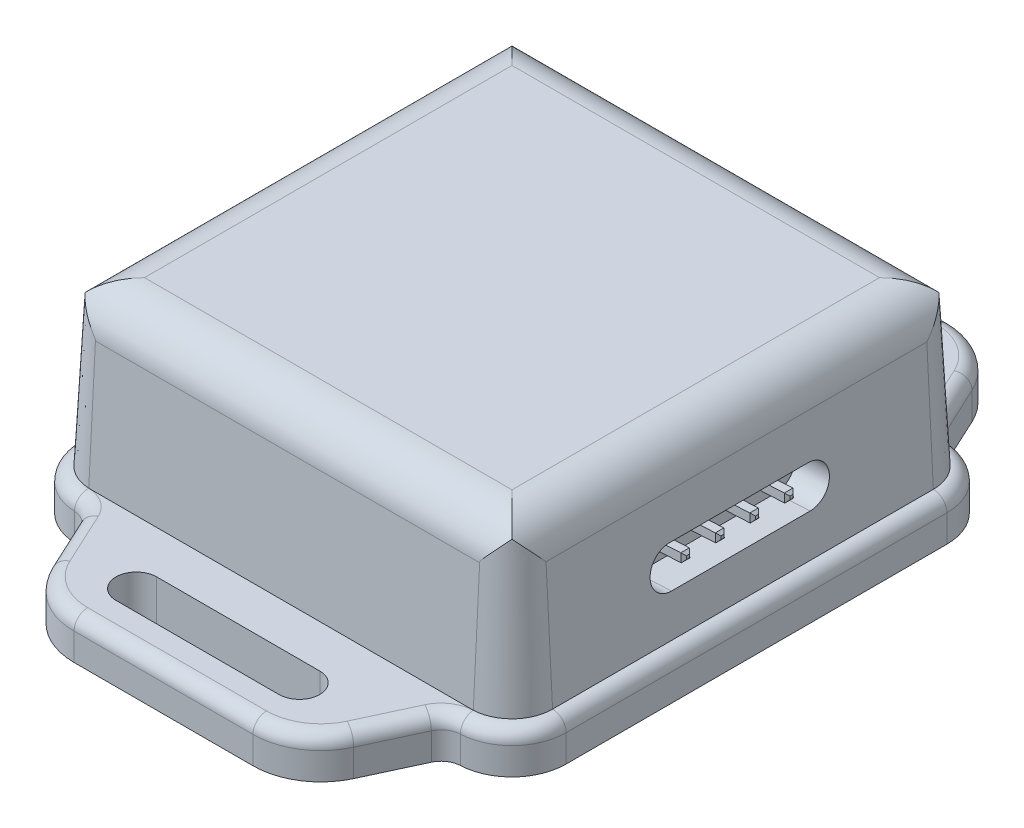
from build123d import *

# Parameters (mm, degrees)
EXTRUDE_1_DEPTH     = 3
FILLET_1_R          = 1
EXTRUDE_2_DEPTH     = 12
EXTRUDE_2_TAPER     = 3
FILLET_3_R          = 3
FILLET_4_R          = 3
CUT_EXTRUDE_1_DEPTH = 2.54
SKETCH_5_W          = 0.63
SKETCH_5_H          = 0.63
EXTRUDE_3_DEPTH     = 2.54
CHAMFER_2_SIZE      = 0.2
CHAMFER_3_SIZE      = 0.2
CUT_EXTRUDE_2_DEPTH = 5.08
EXTRUDE_4_DEPTH     = 2.54
SKETCH_8_R          = 1.5
CUT_EXTRUDE_3_DEPTH = 0.1


with BuildPart() as part:
    # 草图1 → 凸台-拉伸1 (new body)
    with BuildSketch(Plane(origin=(0, 0, 0), x_dir=(1, 0, 0), z_dir=(0, 1, 0))):
        with BuildLine():
            ThreePointArc((11.109578501, 22.761132302), (9.268225449, 24.866230509), (6.58350481, 25.65))
            Line((6.58350481, 25.65), (-6.58350481, 25.65))
            ThreePointArc((-6.58350481, 25.65), (-9.268225449, 24.866230509), (-11.109578501, 22.761132302))
            Line((-11.109578501, 22.761132302), (-12.92017347, 18.860908481))
            ThreePointArc((-12.92017347, 18.860908481), (-13.440232827, 18.25183334), (-14.200505299, 18))
            ThreePointArc((-14.200505299, 18), (-16.897924527, 16.767729012), (-18, 14.014550498))
            Line((-18, 14.014550498), (-18, 13.985449502))
            Line((-18, 13.985449502), (-18, -13.985449502))
            Line((-18, -13.985449502), (-18, -14.014550498))
            ThreePointArc((-18, -14.014550498), (-16.897924527, -16.767729012), (-14.200505299, -18))
            ThreePointArc((-14.200505299, -18), (-13.440232827, -18.25183334), (-12.92017347, -18.860908481))
            Line((-12.92017347, -18.860908481), (-11.109578501, -22.761132302))
            ThreePointArc((-11.109578501, -22.761132302), (-9.268225449, -24.866230509), (-6.58350481, -25.65))
            Line((-6.58350481, -25.65), (6.58350481, -25.65))
            ThreePointArc((6.58350481, -25.65), (9.268225449, -24.866230509), (11.109578501, -22.761132302))
            Line((11.109578501, -22.761132302), (12.92017347, -18.860908481))
            ThreePointArc((12.92017347, -18.860908481), (13.440232827, -18.25183334), (14.200505299, -18))
            ThreePointArc((14.200505299, -18), (16.897924527, -16.767729012), (18, -14.014550498))
            Line((18, -14.014550498), (18, 14.014550498))
            ThreePointArc((18, 14.014550498), (16.897924527, 16.767729012), (14.200505299, 18))
            ThreePointArc((14.200505299, 18), (13.440232827, 18.25183334), (12.92017347, 18.860908481))
            Line((12.92017347, 18.860908481), (11.109578501, 22.761132302))
        make_face()
        with BuildLine():
            Line((6, -23.15), (-6, -23.15))
            ThreePointArc((-6, -23.15), (-7.5, -21.65), (-6, -20.15))
            Line((-6, -20.15), (6, -20.15))
            ThreePointArc((6, -20.15), (7.5, -21.65), (6, -23.15))
        make_face(mode=Mode.SUBTRACT)
        with BuildLine():
            ThreePointArc((-6, 20.15), (-7.5, 21.65), (-6, 23.15))
            Line((-6, 23.15), (6, 23.15))
            ThreePointArc((6, 23.15), (7.5, 21.65), (6, 20.15))
            Line((6, 20.15), (-6, 20.15))
        make_face(mode=Mode.SUBTRACT)
    extrude(amount=EXTRUDE_1_DEPTH)

    # 圆角1
    fillet_1_edges = [part.edges().sort_by_distance(p)[0] for p in [
        (-12.014875986, 3, 20.811020391),
        (-9.268225449, 3, 24.866230509),
        (0, 3, 25.65),
        (9.268225449, 3, 24.866230509),
        (12.014875986, 3, 20.811020391),
        (13.440232827, 3, 18.25183334),
        (16.897924527, 3, 16.767729012),
        (18, 3, 0),
        (16.897924527, 3, -16.767729012),
        (13.440232827, 3, -18.25183334),
        (12.014875986, 3, -20.811020391),
        (9.268225449, 3, -24.866230509),
        (0, 3, -25.65),
        (-9.268225449, 3, -24.866230509),
        (-12.014875986, 3, -20.811020391),
        (-13.440232827, 3, -18.25183334),
        (-16.897924527, 3, -16.767729012),
        (-18, 3, 0),
        (-16.897924527, 3, 16.767729012),
        (-13.440232827, 3, 18.25183334),
    ]]
    fillet(fillet_1_edges, radius=FILLET_1_R)

    # 草图2 → 凸台-拉伸2 (add)
    with BuildSketch(Plane(origin=(0, 3, 0), x_dir=(1, 0, 0), z_dir=(0, 1, 0))):
        with BuildLine():
            ThreePointArc((-14.15275961, 17.001140476), (-16.174133919, 16.077709334), (-17, 14.014550498))
            Line((-17, 14.014550498), (-17, -14.014550498))
            ThreePointArc((-17, -14.014550498), (-16.174133919, -16.077709334), (-14.15275961, -17.001140476))
            Line((-14.15275961, -17.001140476), (14.15275961, -17.001140476))
            ThreePointArc((14.15275961, -17.001140476), (16.174133919, -16.077709334), (17, -14.014550498))
            Line((17, -14.014550498), (17, 14.014550498))
            ThreePointArc((17, 14.014550498), (16.174133919, 16.077709334), (14.15275961, 17.001140476))
            Line((14.15275961, 17.001140476), (-14.15275961, 17.001140476))
        make_face()
    extrude(amount=EXTRUDE_2_DEPTH, taper=EXTRUDE_2_TAPER)

    # 圆角3
    # the kernel refuses this fillet: 3 mm, written as the material it takes off along each edge
    with BuildSketch(Plane(origin=(-21.254085444, 15, 16.372247124), x_dir=(0, 0, -1), z_dir=(1, 0, 0))) as fillet_3_piece_1:
        with BuildLine():
            CenterArc((FILLET_3_R * 0.948964566715, -FILLET_3_R), FILLET_3_R, 90, 87)
            Line((-FILLET_3_R * 0.0496649680397, -FILLET_3_R * 0.947664043757), (0, 0))
            Line((0, 0), (FILLET_3_R * 0.948964566715, 0))
        make_face()
    extrude(amount=42.508170888, mode=Mode.SUBTRACT)
    with BuildSketch(Plane(origin=(21.254085444, 15, -16.372247124), x_dir=(0, -0.9986295347545739, -0.05233595624294369), z_dir=(-1, 0, 0))) as fillet_3_piece_2:
        with BuildLine():
            CenterArc((FILLET_3_R * 0.948964566715, FILLET_3_R), FILLET_3_R, 183, 87)
            Line((-FILLET_3_R * 0.0496649680397, FILLET_3_R * 0.947664043757), (0, 0))
            Line((0, 0), (FILLET_3_R * 0.948964566715, 0))
        make_face()
    extrude(amount=42.508170888, mode=Mode.SUBTRACT)

    # 圆角4
    # the kernel refuses this fillet: 3 mm, written as the material it takes off along each edge
    with BuildSketch(Plane(origin=(-16.371106649, 15, -20.642587675), x_dir=(-0.052335956242944966, -0.9986295347545738, 0), z_dir=(0, 0, 1)), Plane(origin=(16.371106649, 15, 20.642587675), x_dir=(0.05233595624294368, -0.9986295347545738, 0), z_dir=(0, 0, -1))) as fillet_4_piece_1:
        with BuildLine():
            CenterArc((FILLET_4_R * 0.948964566715, FILLET_4_R), FILLET_4_R, 183, 87)
            Line((-FILLET_4_R * 0.0496649680397, FILLET_4_R * 0.947664043757), (0, 0))
            Line((0, 0), (FILLET_4_R * 0.948964566715, 0))
        make_face()
    extrude(amount=41.285175349, mode=Mode.SUBTRACT)

    # 草图4 → 切除-拉伸1 (cut)
    with BuildSketch(Plane(origin=(17.110228806, 0.896709095, 0), x_dir=(0, 0, -1), z_dir=(0.998629534754574, 0.05233595624294391, 0))):
        with BuildLine():
            Line((-5.1, 8.106177348), (5.1, 8.106177348))
            ThreePointArc((5.1, 8.106177348), (6.6, 6.606177348), (5.1, 5.106177348))
            Line((5.1, 5.106177348), (-5.1, 5.106177348))
            ThreePointArc((-5.1, 5.106177348), (-6.6, 6.606177348), (-5.1, 8.106177348))
        make_face()
    extrude(amount=-CUT_EXTRUDE_1_DEPTH, mode=Mode.SUBTRACT)

    # 草图5 → 凸台-拉伸3 (add)
    with BuildSketch(Plane(origin=(14.573709787, 0.763775766, 0), x_dir=(0, 0, -1), z_dir=(0.998629534754574, 0.05233595624294393, 0))):
        with Locations((-1.27, 6.606177348)):
            Rectangle(SKETCH_5_W, SKETCH_5_H)
        with Locations((-3.81, 6.606177348)):
            Rectangle(SKETCH_5_W, SKETCH_5_H)
        with Locations((1.27, 6.606177348)):
            Rectangle(SKETCH_5_W, SKETCH_5_H)
        with Locations((3.81, 6.606177348)):
            Rectangle(SKETCH_5_W, SKETCH_5_H)
    extrude(amount=EXTRUDE_3_DEPTH)

    # 倒角2
    chamfer_2_edges = [part.edges().sort_by_distance(p)[0] for p in [
        (16.780974023, 7.179264603, 3.81),
        (16.764488197, 7.493832906, 4.125),
        (16.748002371, 7.80840121, 3.81),
        (16.764488197, 7.493832906, 3.495),
    ]]
    chamfer(chamfer_2_edges, length=CHAMFER_2_SIZE)

    # 倒角3
    chamfer_3_edges = [part.edges().sort_by_distance(p)[0] for p in [
        (16.764488197, 7.493832906, 1.585),
        (16.748002371, 7.80840121, 1.27),
        (16.764488197, 7.493832906, 0.955),
        (16.780974023, 7.179264603, 1.27),
        (16.764488197, 7.493832906, -0.955),
        (16.748002371, 7.80840121, -1.27),
        (16.764488197, 7.493832906, -1.585),
        (16.780974023, 7.179264603, -1.27),
        (16.764488197, 7.493832906, -3.495),
        (16.748002371, 7.80840121, -3.81),
        (16.764488197, 7.493832906, -4.125),
        (16.780974023, 7.179264603, -3.81),
    ]]
    chamfer(chamfer_3_edges, length=CHAMFER_3_SIZE)

    # 草图6 → 切除-拉伸2 (cut)
    with BuildSketch(Plane(origin=(-17.110228806, 0.896709095, 0), x_dir=(0, 0, 1), z_dir=(-0.998629534754574, 0.05233595624294391, -1.6069369669372317e-15))):
        with BuildLine():
            Line((-2.9, 7.606177348), (2.9, 7.606177348))
            ThreePointArc((2.9, 7.606177348), (4.15, 6.356177348), (2.9, 5.106177348))
            Line((2.9, 5.106177348), (-2.9, 5.106177348))
            ThreePointArc((-2.9, 5.106177348), (-4.15, 6.356177348), (-2.9, 7.606177348))
        make_face()
    extrude(amount=-CUT_EXTRUDE_2_DEPTH, mode=Mode.SUBTRACT)

    # 草图7 → 凸台-拉伸4 (add)
    with BuildSketch(Plane(origin=(-12.037190769, 0.630842437, 0), x_dir=(0, 0, 1), z_dir=(-0.998629534754574, 0.05233595624294393, -1.6069369669372323e-15))):
        with BuildLine():
            Line((-2.5, 6.431177348), (2.5, 6.431177348))
            ThreePointArc((2.5, 6.431177348), (2.575, 6.356177348), (2.5, 6.281177348))
            Line((2.5, 6.281177348), (-2.5, 6.281177348))
            ThreePointArc((-2.5, 6.281177348), (-2.575, 6.356177348), (-2.5, 6.431177348))
        make_face()
    extrude(amount=EXTRUDE_4_DEPTH)

    # 草图8 → 切除-拉伸3 (cut)
    with BuildSketch(Plane.XZ):
        with Locations(Location((14.01, 14.014550498, 0), (0, 0, 270))):
            Circle(SKETCH_8_R)
        with Locations(Location((-14.01, -14.014550498, 0), (0, 0, 270))):
            Circle(SKETCH_8_R)
    extrude(amount=-CUT_EXTRUDE_3_DEPTH, mode=Mode.SUBTRACT)


solid = part.part
